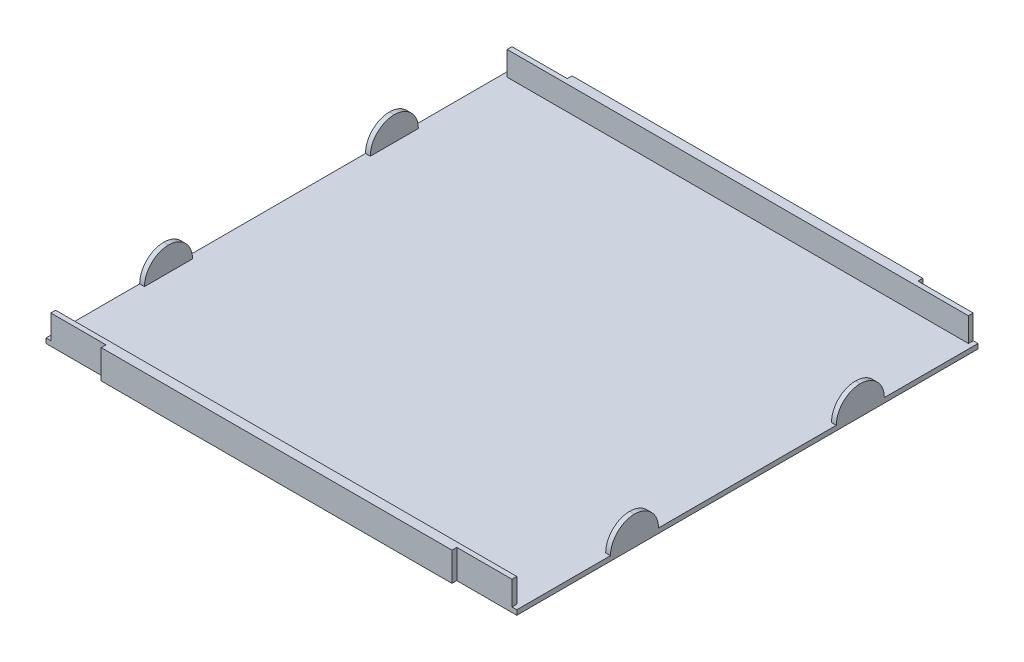
from build123d import *

# Parameters (mm, degrees)
SKETCH1_W           = 98
SKETCH1_H           = 96
SKETCH1_W_2         = 73
SKETCH1_H_2         = 1
BOSS_EXTRUDE1_DEPTH = 1
SKETCH2_W           = 73
SKETCH2_H           = 1
BOSS_EXTRUDE2_DEPTH = 5
SKETCH3_W           = 98
SKETCH3_H           = 1
BOSS_EXTRUDE3_DEPTH = 5
SKETCH4_W           = 1
SKETCH4_H           = 10
BOSS_EXTRUDE4_DEPTH = 5
FILLET1_R           = 5
FILLET2_R           = 5
SKETCH5_W           = 1
SKETCH5_H           = 1
CUT_EXTRUDE1_DEPTH  = 5


with BuildPart() as part:
    # Sketch1 → Boss-Extrude1 (new body)
    with BuildSketch(Plane(origin=(0, 0, 0), x_dir=(1, 0, 0), z_dir=(0, 1, 0))):
        with Locations((49, 48)):
            Rectangle(SKETCH1_W, SKETCH1_H)
        with Locations((49, 96.5)):
            Rectangle(SKETCH1_W_2, SKETCH1_H_2)
        with Locations((49, -0.5)):
            Rectangle(SKETCH1_W_2, SKETCH1_H_2)
    extrude(amount=BOSS_EXTRUDE1_DEPTH)

    # Sketch2 → Boss-Extrude2 (add)
    with BuildSketch(Plane(origin=(0, 1, 0), x_dir=(1, 0, 0), z_dir=(0, 1, 0))):
        with Locations((49, -0.5)):
            Rectangle(SKETCH2_W, SKETCH2_H)
        with Locations((49, 96.5)):
            Rectangle(SKETCH2_W, SKETCH2_H)
    extrude(amount=BOSS_EXTRUDE2_DEPTH)

    # Sketch3 → Boss-Extrude3 (add)
    with BuildSketch(Plane(origin=(0, 1, 0), x_dir=(1, 0, 0), z_dir=(0, 1, 0))):
        with Locations((49, 95.5)):
            Rectangle(SKETCH3_W, SKETCH3_H)
        with Locations((49, 0.5)):
            Rectangle(SKETCH3_W, SKETCH3_H)
    extrude(amount=BOSS_EXTRUDE3_DEPTH)

    # Sketch4 → Boss-Extrude4 (add)
    with BuildSketch(Plane(origin=(0, 1, 0), x_dir=(1, 0, 0), z_dir=(0, 1, 0))):
        with Locations((0.5, 71.5)):
            Rectangle(SKETCH4_W, SKETCH4_H)
        with Locations((0.5, 24.5)):
            Rectangle(SKETCH4_W, SKETCH4_H)
        with Locations((97.5, 71.5)):
            Rectangle(SKETCH4_W, SKETCH4_H)
        with Locations((97.5, 24.5)):
            Rectangle(SKETCH4_W, SKETCH4_H)
    extrude(amount=BOSS_EXTRUDE4_DEPTH)

    # Fillet1
    fillet1_edges = [part.edges().sort_by_distance(p)[0] for p in [
        (97.5, 6, -19.5),
        (97.5, 6, -29.5),
    ]]
    fillet(fillet1_edges, radius=FILLET1_R - 0.0001)  # a hair under: the kernel refuses the full size

    # Fillet2
    fillet2_edges = [part.edges().sort_by_distance(p)[0] for p in [
        (0.5, 6, -29.5),
        (0.5, 6, -19.5),
        (0.5, 6, -66.5),
        (0.5, 6, -76.5),
        (97.5, 6, -66.5),
        (97.5, 6, -76.5),
    ]]
    fillet(fillet2_edges, radius=FILLET2_R - 0.0001)  # a hair under: the kernel refuses the full size

    # Sketch5 → Cut-Extrude1 (cut)
    with BuildSketch(Plane(origin=(0, 6, 0), x_dir=(1, 0, 0), z_dir=(0, 1, 0))):
        with Locations((0.5, 0.5)):
            Rectangle(SKETCH5_W, SKETCH5_H)
        with Locations((97.5, 0.5)):
            Rectangle(SKETCH5_W, SKETCH5_H)
        with Locations((97.5, 95.5)):
            Rectangle(SKETCH5_W, SKETCH5_H)
        with Locations((0.5, 95.5)):
            Rectangle(SKETCH5_W, SKETCH5_H)
    extrude(amount=-CUT_EXTRUDE1_DEPTH, mode=Mode.SUBTRACT)


solid = part.part
